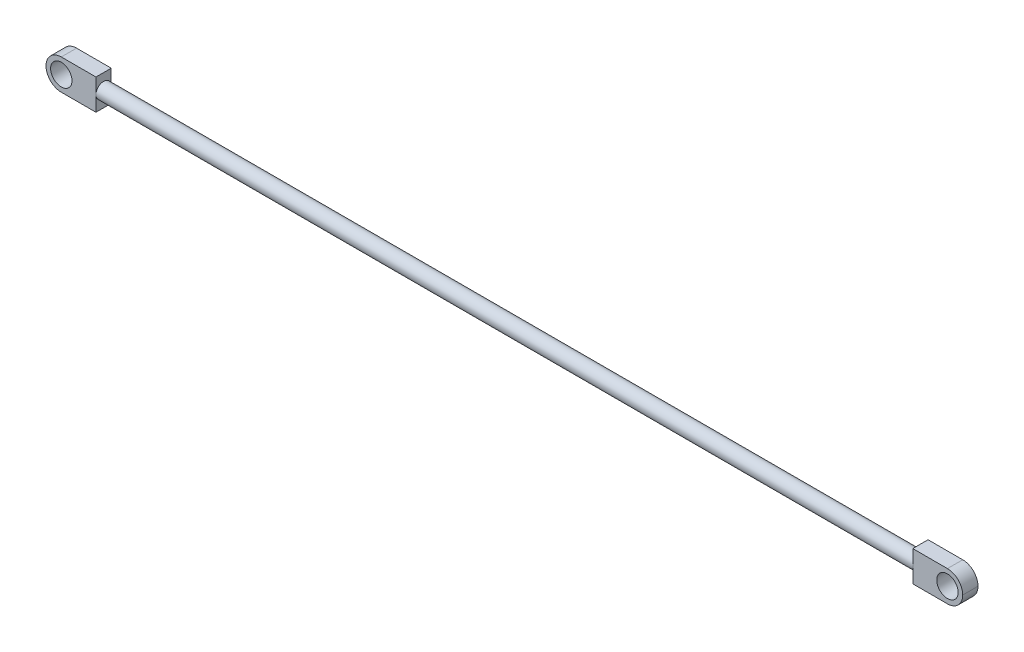
from build123d import *

# Parameters (mm, degrees)
SKETCH_1_W          = 600
SKETCH_1_H          = 20
SKETCH_1_R          = 7
EXTRUDE_1_DEPTH     = 10
FILLET_1_R          = 10
SKETCH1_W           = 534.59629528
SKETCH1_H           = 41.86621972
CUT_EXTRUDE1_DEPTH  = 19
SKETCH2_R           = 5
BOSS_EXTRUDE1_DEPTH = 535


with BuildPart() as part:
    # 草图1 → 凸台-拉伸1 (new body)
    with BuildSketch(Plane.XY):
        Rectangle(SKETCH_1_W, SKETCH_1_H)
        with Locations((-290, 0)):
            Circle(SKETCH_1_R, mode=Mode.SUBTRACT)
        with Locations((290, 0)):
            Circle(SKETCH_1_R, mode=Mode.SUBTRACT)
    extrude(amount=EXTRUDE_1_DEPTH)

    # 圆角1
    fillet_1_edges = [part.edges().sort_by_distance(p)[0] for p in [
        (300, 10, 5),
        (300, -10, 5),
        (-300, -10, 5),
        (-300, 10, 5),
    ]]
    fillet(fillet_1_edges, radius=FILLET_1_R - 0.0001)  # a hair under: the kernel refuses the full size

    # Sketch1 → Cut-Extrude1 (cut)
    with BuildSketch(Plane.XY):
        Rectangle(SKETCH1_W, SKETCH1_H)
    extrude(amount=CUT_EXTRUDE1_DEPTH, mode=Mode.SUBTRACT)


with BuildPart() as cut_extrude1_piece_1:
    # of the separate pieces the step leaves, piece 1, a body of its own (cut_extrude1_pieces)
    add(part.part.solids().sort_by_distance((-290.0001, -10, 0))[0])



with BuildPart() as cut_extrude1_piece_2:
    # of the separate pieces the step leaves, piece 2, a body of its own (cut_extrude1_pieces)
    add(part.part.solids().sort_by_distance((267.29814764, -10, 0))[0])


with BuildPart() as cut_extrude1_piece_1_1:
    add(cut_extrude1_piece_1.part)

    add(cut_extrude1_piece_2.part)  # Boss-Extrude1 merges Cut-Extrude1 piece 2
    # Sketch2 → Boss-Extrude1 (add)
    with BuildSketch(Plane(origin=(-267.29814764, 0, 0), x_dir=(0, 0, -1), z_dir=(1, 0, 0))):
        with Locations(Location((-5, 0, 0), (0, 0, 180))):
            Circle(SKETCH2_R)
    extrude(amount=BOSS_EXTRUDE1_DEPTH)


solid = cut_extrude1_piece_1_1.part
